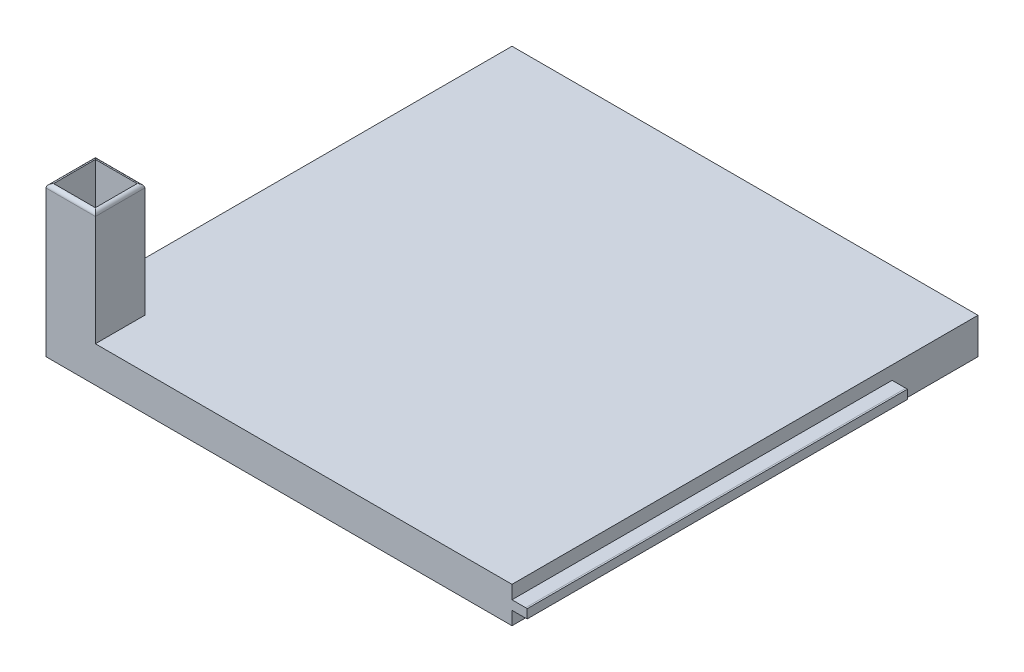
from build123d import *

# Parameters (mm, degrees)
SKETCH1_W           = 155.7
SKETCH1_H           = 155.7
BOSS_EXTRUDE2_DEPTH = 12
SKETCH2_W           = 16.5
SKETCH2_H           = 16.5
BOSS_EXTRUDE3_DEPTH = 38.1
SKETCH3_W           = 5.08
SKETCH3_H           = 3.048
BOSS_EXTRUDE4_DEPTH = 127
CHAMFER1_SIZE       = 0.508
CHAMFER1_SIZE2      = 0.03552282
CHAMFER2_SIZE       = 0.508
CHAMFER2_SIZE2      = 0.03552282
SKETCH4_W           = 5.334
SKETCH4_H           = 3.175
CUT_EXTRUDE3_DEPTH  = 149.86
FILLET1_R           = 1.27
SKETCH5_W           = 13.96
SKETCH5_H           = 13.96
CUT_EXTRUDE4_DEPTH  = 38


with BuildPart() as part:
    # Sketch1 → Boss-Extrude2 (new body)
    with BuildSketch(Plane(origin=(0, 0, 0), x_dir=(1, 0, 0), z_dir=(0, 1, 0))):
        with Locations((55.528787879, -61.975)):
            Rectangle(SKETCH1_W, SKETCH1_H)
    extrude(amount=BOSS_EXTRUDE2_DEPTH)

    # Sketch2 → Boss-Extrude3 (add)
    with BuildSketch(Plane(origin=(0, 12, 0), x_dir=(1, 0, 0), z_dir=(0, 1, 0))):
        with Locations((-14.071212121, -131.575)):
            Rectangle(SKETCH2_W, SKETCH2_H)
    extrude(amount=BOSS_EXTRUDE3_DEPTH)

    # Sketch3 → Boss-Extrude4 (add)
    with BuildSketch(Plane.XY.offset(139.825)):
        with Locations((135.918787879, 6)):
            Rectangle(SKETCH3_W, SKETCH3_H)
    extrude(amount=-BOSS_EXTRUDE4_DEPTH)

    # Chamfer1
    chamfer1_edges = [part.edges().sort_by_distance(p)[0] for p in [
        (138.458787879, 7.524, 76.325),
    ]]
    chamfer1_side = [part.faces().sort_by_distance(p)[0] for p in [
        (135.918787879, 7.524, 76.325),
    ]]
    chamfer(chamfer1_edges, length=CHAMFER1_SIZE, length2=CHAMFER1_SIZE2, reference=chamfer1_side[0])

    # Chamfer2
    chamfer2_edges = [part.edges().sort_by_distance(p)[0] for p in [
        (138.458787879, 4.476, 76.325),
    ]]
    chamfer2_side = [part.faces().sort_by_distance(p)[0] for p in [
        (135.918787879, 4.476, 76.325),
    ]]
    chamfer(chamfer2_edges, length=CHAMFER2_SIZE, length2=CHAMFER2_SIZE2, reference=chamfer2_side[0])

    # Sketch4 → Cut-Extrude3 (cut)
    with BuildSketch(Plane.ZY.offset(22.321212121)):
        with Locations((-13.208, 6)):
            Rectangle(SKETCH4_W, SKETCH4_H)
    extrude(amount=-CUT_EXTRUDE3_DEPTH, mode=Mode.SUBTRACT)

    # Fillet1
    fillet1_edges = [part.edges().sort_by_distance(p)[0] for p in [
        (-22.321212121, 50.1, 131.575),
        (-14.071212121, 50.1, 139.825),
        (-5.821212121, 50.1, 131.575),
        (-14.071212121, 50.1, 123.325),
    ]]
    fillet(fillet1_edges, radius=FILLET1_R)

    # Sketch5 → Cut-Extrude4 (cut)
    with BuildSketch(Plane(origin=(0, 50.1, 0), x_dir=(1, 0, 0), z_dir=(0, 1, 0))):
        with Locations((-14.071212121, -131.575)):
            Rectangle(SKETCH5_W, SKETCH5_H)
    extrude(amount=-CUT_EXTRUDE4_DEPTH, mode=Mode.SUBTRACT)


solid = part.part
